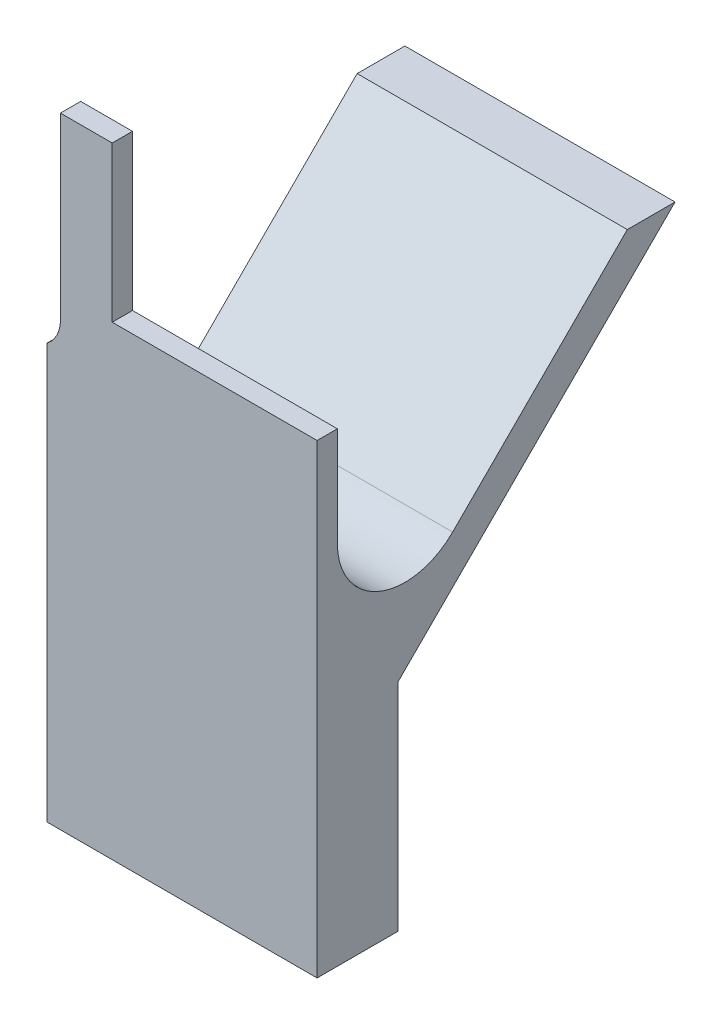
from build123d import *

# Parameters (mm, degrees)
SKETCH_1_W          = 40
SKETCH_1_H          = 32
EXTRUDE_1_DEPTH     = 12
EXTRUDE_2_DEPTH     = 3
FILLET_1_R          = 10
EXTRUDE_3_DEPTH     = 40
FILLET_2_R          = 10
CUT_EXTRUDE_4_DEPTH = 106.156697477
EXTRUDE_4_DEPTH     = 10
EXTRUDE_5_DEPTH     = 10
EXTRUDE_6_DEPTH     = 10
EXTRUDE_7_DEPTH     = 10
FILLET_3_R          = 3
EXTRUDE_8_DEPTH     = 3
SKETCH_11_W         = 29.594040462
SKETCH_11_H         = 15.509477318
CUT_EXTRUDE_5_DEPTH = 125.135450215


with BuildPart() as part:
    # Эскиз1 → Бобышка-Вытянуть1 (new body)
    with BuildSketch(Plane.XY):
        with Locations((20, 16)):
            Rectangle(SKETCH_1_W, SKETCH_1_H)
    extrude(amount=EXTRUDE_1_DEPTH)

    # Эскиз2 → Бобышка-Вытянуть2 (add)
    with BuildSketch(Plane.XY.offset(12)):
        Polygon((40, 68.92), (9.67, 68.92), (9.67, 61.4), (0, 61.4), (0, 32), (9.67, 32), (40, 32), align=None)
    extrude(amount=-EXTRUDE_2_DEPTH)

    # Скругление1
    # the kernel refuses this fillet: 10 mm, written as the material it adds along each edge
    with BuildSketch(Plane(origin=(0, 32, 9), x_dir=(0, 1, 0), z_dir=(1, 0, 0))) as fillet_1_piece_1:
        with BuildLine():
            CenterArc((9.949874371, -10), FILLET_1_R, 90, 84.260829523)
            Line((0, -9), (-0.198997487, -8.98))
            ThreePointArc((-0.198997487, -8.98), (-0.2, -4.5), (-0.2, 0))
            Line((-0.2, 0), (0, 0.2))
            Line((0, 0.2), (9.949874371, 0.2))
            Line((9.949874371, 0.2), (9.949874371, 0))
        make_face()
    extrude(amount=40)

    # Эскиз3 → Бобышка-Вытянуть3 (add)
    with BuildSketch(Plane.ZY):
        Polygon((-50, 82), (0, 32), (0.953231177, 30.366676535), (6.580561568, 32.490506244), (-44.343145751, 83.414213562), align=None)
    extrude(amount=-EXTRUDE_3_DEPTH)

    # Скругление2
    # the kernel refuses this fillet: 10 mm, written as the material it adds along each edge
    with BuildSketch(Plane(origin=(40, 34.002081727, 5.068986084), x_dir=(0, 0.9816056191455192, 0.19091990064406986), z_dir=(-1, 0, 0))) as fillet_2_piece_1:
        with BuildLine():
            CenterArc((18.680660418, 9.816056191), FILLET_2_R, 146.006473408, 135)
            Line((10.389652956, 15.407048525), (9.56055221, 15.966147758))
            Line((9.56055221, 15.966147758), (-0.829100746, 0.559099233))
            Line((-0.829100746, 0.559099233), (-0.66429077, -0.747474262))
            ThreePointArc((-0.66429077, -0.747474262), (8.743026606, -3.322919186), (20.780779325, -0.981605619))
            Line((20.780779325, -0.981605619), (20.589859424, 0))
        make_face()
    extrude(amount=40)

    # Эскиз5 → Вырез-Вытянуть4 (cut, through all)
    with BuildSketch(Plane(origin=(40, 0, 0), x_dir=(0, 0, -1), z_dir=(1, 0, 0))):
        Polygon((50, 82), (39.176517875, 82), (40.76887279, 85.052981815), (48.441128294, 85.535513608), align=None)
    extrude(amount=-CUT_EXTRUDE_4_DEPTH, mode=Mode.SUBTRACT)

    # Эскиз6 → Бобышка-Вытянуть4 (add)
    with BuildSketch(Plane(origin=(40, 0, 0), x_dir=(0, 0, -1), z_dir=(1, 0, 0))):
        Polygon((34.928932188, 74), (42, 74), (50, 82), (42.928932188, 82), align=None)
    extrude(amount=EXTRUDE_4_DEPTH)

    # Эскиз7 → Бобышка-Вытянуть5 (add)
    with BuildSketch(Plane.ZY):
        Polygon((-42, 74), (-34.928932188, 74), (-42.928932188, 82), (-50, 82), align=None)
    extrude(amount=EXTRUDE_5_DEPTH)

    # Эскиз8 → Бобышка-Вытянуть6 (add)
    with BuildSketch(Plane.ZY.offset(10)):
        Polygon((-42, 74), (-58, 74), (-58, 82), (-50, 82), align=None)
    extrude(amount=-EXTRUDE_6_DEPTH)

    # Эскиз9 → Бобышка-Вытянуть7 (add)
    with BuildSketch(Plane(origin=(50, 0, 0), x_dir=(0, 0, -1), z_dir=(1, 0, 0))):
        Polygon((42, 74), (58, 74), (58, 82), (50, 82), align=None)
    extrude(amount=-EXTRUDE_7_DEPTH)

    # Скругление3
    fillet_3_edges = [part.edges().sort_by_distance(p)[0] for p in [
        (0, 78, -46),
        (40, 78, -46),
    ]]
    fillet(fillet_3_edges, radius=FILLET_3_R)

    # Эскиз10 → Бобышка-Вытянуть8 (add)
    with BuildSketch(Plane(origin=(0, 0, 12), x_dir=(-1, 0, 0), z_dir=(0, 0, -1))):
        with BuildLine():
            Line((-9.67, 91.9), (-2, 91.9))
            Line((-2, 91.9), (-2, 65.4))
            ThreePointArc((-2, 65.4), (-1.472135955, 63.163932023), (0, 61.4))
            Line((0, 61.4), (-9.67, 61.4))
            Line((-9.67, 61.4), (-9.67, 91.9))
        make_face()
    extrude(amount=EXTRUDE_8_DEPTH)

    # Эскиз11 → Вырез-Вытянуть5 (cut, through all)
    with BuildSketch(Plane(origin=(50, 0, 0), x_dir=(0, 0, -1), z_dir=(1, 0, 0))):
        with Locations((46.795384827, 80.754738659)):
            Rectangle(SKETCH_11_W, SKETCH_11_H)
    extrude(amount=-CUT_EXTRUDE_5_DEPTH, mode=Mode.SUBTRACT)


solid = part.part
